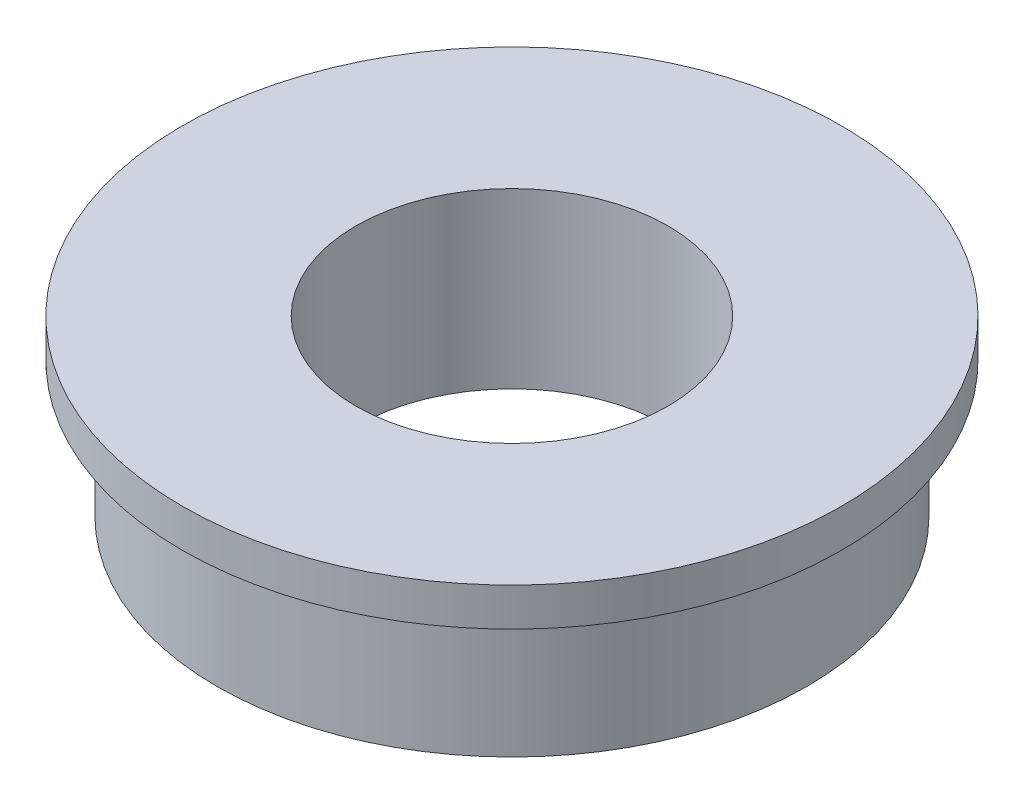
from build123d import *

# Parameters (mm, degrees)
SKETCH2_R           = 8.5
SKETCH2_R_2         = 4.5
BOSS_EXTRUDE1_DEPTH = 5
BOSS_EXTRUDE2_START = -1.1
SKETCH3_R           = 9.5
SKETCH3_R_2         = 8.5
BOSS_EXTRUDE2_DEPTH = 1.1


with BuildPart() as part:
    # Sketch2 → Boss-Extrude1 (new body)
    with BuildSketch(Plane(origin=(0, 0, 0), x_dir=(1, 0, 0), z_dir=(0, 1, 0))):
        Circle(SKETCH2_R)
        Circle(SKETCH2_R_2, mode=Mode.SUBTRACT)
    extrude(amount=BOSS_EXTRUDE1_DEPTH)

    # Sketch3 → Boss-Extrude2 (add)
    with BuildSketch(Plane(origin=(0, 5, 0), x_dir=(1, 0, 0), z_dir=(0, 1, 0)).offset(BOSS_EXTRUDE2_START)):
        Circle(SKETCH3_R)
        Circle(SKETCH3_R_2, mode=Mode.SUBTRACT)
    extrude(amount=BOSS_EXTRUDE2_DEPTH)


solid = part.part
